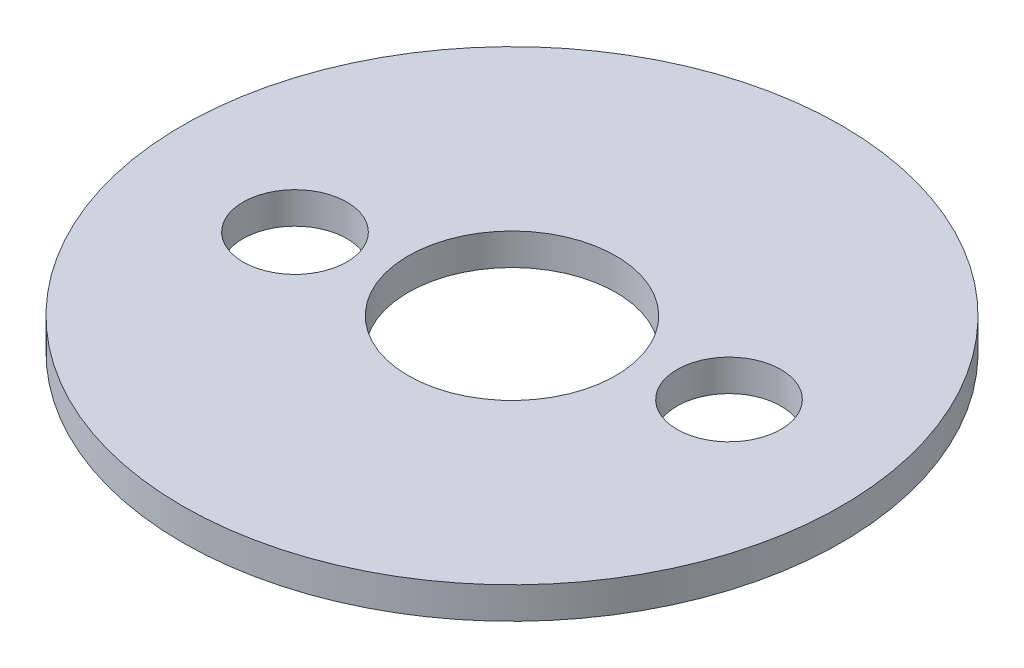
from build123d import *

# Parameters (mm, degrees)
SKETCH1_R           = 2.5
BOSS_EXTRUDE1_DEPTH = 4.7625
SKETCH2_R           = 7.9375
SKETCH2_R_2         = 2.5
BOSS_EXTRUDE2_DEPTH = 0.762
SKETCH4_R           = 1
CUT_EXTRUDE2_DEPTH  = 15.721869362
SKETCH5_R           = 1.25
CUT_EXTRUDE3_DEPTH  = 15.721869362


with BuildPart() as part:
    # Sketch1 → Boss-Extrude1 (new, symmetric)
    with BuildSketch(Plane(origin=(0, 0, 0), x_dir=(1, 0, 0), z_dir=(0, 1, 0))):
        with BuildLine():
            ThreePointArc((-1.850768, -6.777037356), (-1.816941892, -6.962421006), (-1.663291889, -7.071521784))
            ThreePointArc((-1.663291889, -7.071521784), (-1.417233644, -7.124914669), (-1.169472895, -7.169748489))
            ThreePointArc((-1.169472895, -7.169748489), (-0.985767742, -7.127751824), (-0.883573242, -6.969424355))
            ThreePointArc((-0.883573242, -6.969424355), (-0.839120956, -6.792881518), (-0.773880597, -6.622919538))
            ThreePointArc((-0.773880597, -6.622919538), (0, -6.1245), (0.773880597, -6.622919538))
            ThreePointArc((0.773880597, -6.622919538), (0.839120956, -6.792881518), (0.883573242, -6.969424355))
            ThreePointArc((0.883573242, -6.969424355), (0.985767742, -7.127751824), (1.169472895, -7.169748489))
            ThreePointArc((1.169472895, -7.169748489), (1.417233644, -7.124914669), (1.663291889, -7.071521784))
            ThreePointArc((1.663291889, -7.071521784), (1.816941892, -6.962421006), (1.850768, -6.777037356))
            ThreePointArc((1.850768, -6.777037356), (1.824276538, -6.596921889), (1.819509137, -6.414931089))
            ThreePointArc((1.819509137, -6.414931089), (2.343744682, -5.658300197), (3.249454025, -5.822628523))
            ThreePointArc((3.249454025, -5.822628523), (3.374769892, -5.954686513), (3.483398468, -6.100779674))
            ThreePointArc((3.483398468, -6.100779674), (3.638403174, -6.20794704), (3.824196033, -6.176445981))
            ThreePointArc((3.824196033, -6.176445981), (4.035939958, -6.040210999), (4.242835561, -5.896719991))
            ThreePointArc((4.242835561, -5.896719991), (4.343038594, -5.737124705), (4.303346591, -5.552907854))
            ThreePointArc((4.303346591, -5.552907854), (4.209944466, -5.396640704), (4.135895098, -5.230327534))
            ThreePointArc((4.135895098, -5.230327534), (4.330675481, -4.330675481), (5.230327534, -4.135895098))
            ThreePointArc((5.230327534, -4.135895098), (5.396640704, -4.209944466), (5.552907854, -4.303346591))
            ThreePointArc((5.552907854, -4.303346591), (5.737124705, -4.343038594), (5.896719991, -4.242835561))
            ThreePointArc((5.896719991, -4.242835561), (6.040210999, -4.035939958), (6.176445981, -3.824196033))
            ThreePointArc((6.176445981, -3.824196033), (6.20794704, -3.638403174), (6.100779674, -3.483398468))
            ThreePointArc((6.100779674, -3.483398468), (5.954686513, -3.374769892), (5.822628523, -3.249454025))
            ThreePointArc((5.822628523, -3.249454025), (5.658300197, -2.343744682), (6.414931089, -1.819509137))
            ThreePointArc((6.414931089, -1.819509137), (6.596921889, -1.824276538), (6.777037356, -1.850768))
            ThreePointArc((6.777037356, -1.850768), (6.962421006, -1.816941892), (7.071521784, -1.663291889))
            ThreePointArc((7.071521784, -1.663291889), (7.124914669, -1.417233644), (7.169748489, -1.169472895))
            ThreePointArc((7.169748489, -1.169472895), (7.127751824, -0.985767742), (6.969424355, -0.883573242))
            ThreePointArc((6.969424355, -0.883573242), (6.792881518, -0.839120956), (6.622919538, -0.773880597))
            ThreePointArc((6.622919538, -0.773880597), (6.1245, 0), (6.622919538, 0.773880597))
            ThreePointArc((6.622919538, 0.773880597), (6.792881518, 0.839120956), (6.969424355, 0.883573242))
            ThreePointArc((6.969424355, 0.883573242), (7.127751824, 0.985767742), (7.169748489, 1.169472895))
            ThreePointArc((7.169748489, 1.169472895), (7.124914669, 1.417233644), (7.071521784, 1.663291889))
            ThreePointArc((7.071521784, 1.663291889), (6.962421006, 1.816941892), (6.777037356, 1.850768))
            ThreePointArc((6.777037356, 1.850768), (6.596921889, 1.824276538), (6.414931089, 1.819509137))
            ThreePointArc((6.414931089, 1.819509137), (5.658300197, 2.343744682), (5.822628523, 3.249454025))
            ThreePointArc((5.822628523, 3.249454025), (5.954686513, 3.374769892), (6.100779674, 3.483398468))
            ThreePointArc((6.100779674, 3.483398468), (6.20794704, 3.638403174), (6.176445981, 3.824196033))
            ThreePointArc((6.176445981, 3.824196033), (6.040210999, 4.035939958), (5.896719991, 4.242835561))
            ThreePointArc((5.896719991, 4.242835561), (5.737124705, 4.343038594), (5.552907854, 4.303346591))
            ThreePointArc((5.552907854, 4.303346591), (5.396640704, 4.209944466), (5.230327534, 4.135895098))
            ThreePointArc((5.230327534, 4.135895098), (4.330675481, 4.330675481), (4.135895098, 5.230327534))
            ThreePointArc((4.135895098, 5.230327534), (4.209944466, 5.396640704), (4.303346591, 5.552907854))
            ThreePointArc((4.303346591, 5.552907854), (4.343038594, 5.737124705), (4.242835561, 5.896719991))
            ThreePointArc((4.242835561, 5.896719991), (4.035939958, 6.040210999), (3.824196033, 6.176445981))
            ThreePointArc((3.824196033, 6.176445981), (3.638403174, 6.20794704), (3.483398468, 6.100779674))
            ThreePointArc((3.483398468, 6.100779674), (3.374769892, 5.954686513), (3.249454025, 5.822628523))
            ThreePointArc((3.249454025, 5.822628523), (2.343744682, 5.658300197), (1.819509137, 6.414931089))
            ThreePointArc((1.819509137, 6.414931089), (1.824276538, 6.596921889), (1.850768, 6.777037356))
            ThreePointArc((1.850768, 6.777037356), (1.816941892, 6.962421006), (1.663291889, 7.071521784))
            ThreePointArc((1.663291889, 7.071521784), (1.417233644, 7.124914669), (1.169472895, 7.169748489))
            ThreePointArc((1.169472895, 7.169748489), (0.985767742, 7.127751824), (0.883573242, 6.969424355))
            ThreePointArc((0.883573242, 6.969424355), (0.839120956, 6.792881518), (0.773880597, 6.622919538))
            ThreePointArc((0.773880597, 6.622919538), (0, 6.1245), (-0.773880597, 6.622919538))
            ThreePointArc((-0.773880597, 6.622919538), (-0.839120956, 6.792881518), (-0.883573242, 6.969424355))
            ThreePointArc((-0.883573242, 6.969424355), (-0.985767742, 7.127751824), (-1.169472895, 7.169748489))
            ThreePointArc((-1.169472895, 7.169748489), (-1.417233644, 7.124914669), (-1.663291889, 7.071521784))
            ThreePointArc((-1.663291889, 7.071521784), (-1.816941892, 6.962421006), (-1.850768, 6.777037356))
            ThreePointArc((-1.850768, 6.777037356), (-1.824276538, 6.596921889), (-1.819509137, 6.414931089))
            ThreePointArc((-1.819509137, 6.414931089), (-2.343744682, 5.658300197), (-3.249454025, 5.822628523))
            ThreePointArc((-3.249454025, 5.822628523), (-3.374769892, 5.954686513), (-3.483398468, 6.100779674))
            ThreePointArc((-3.483398468, 6.100779674), (-3.638403174, 6.20794704), (-3.824196033, 6.176445981))
            ThreePointArc((-3.824196033, 6.176445981), (-4.035939958, 6.040210999), (-4.242835561, 5.896719991))
            ThreePointArc((-4.242835561, 5.896719991), (-4.343038594, 5.737124705), (-4.303346591, 5.552907854))
            ThreePointArc((-4.303346591, 5.552907854), (-4.209944466, 5.396640704), (-4.135895098, 5.230327534))
            ThreePointArc((-4.135895098, 5.230327534), (-4.330675481, 4.330675481), (-5.230327534, 4.135895098))
            ThreePointArc((-5.230327534, 4.135895098), (-5.396640704, 4.209944466), (-5.552907854, 4.303346591))
            ThreePointArc((-5.552907854, 4.303346591), (-5.737124705, 4.343038594), (-5.896719991, 4.242835561))
            ThreePointArc((-5.896719991, 4.242835561), (-6.040210999, 4.035939958), (-6.176445981, 3.824196033))
            ThreePointArc((-6.176445981, 3.824196033), (-6.20794704, 3.638403174), (-6.100779674, 3.483398468))
            ThreePointArc((-6.100779674, 3.483398468), (-5.954686513, 3.374769892), (-5.822628523, 3.249454025))
            ThreePointArc((-5.822628523, 3.249454025), (-5.658300197, 2.343744682), (-6.414931089, 1.819509137))
            ThreePointArc((-6.414931089, 1.819509137), (-6.596921889, 1.824276538), (-6.777037356, 1.850768))
            ThreePointArc((-6.777037356, 1.850768), (-6.962421006, 1.816941892), (-7.071521784, 1.663291889))
            ThreePointArc((-7.071521784, 1.663291889), (-7.124914669, 1.417233644), (-7.169748489, 1.169472895))
            ThreePointArc((-7.169748489, 1.169472895), (-7.127751824, 0.985767742), (-6.969424355, 0.883573242))
            ThreePointArc((-6.969424355, 0.883573242), (-6.792881518, 0.839120956), (-6.622919538, 0.773880597))
            ThreePointArc((-6.622919538, 0.773880597), (-6.1245, 0), (-6.622919538, -0.773880597))
            ThreePointArc((-6.622919538, -0.773880597), (-6.792881518, -0.839120956), (-6.969424355, -0.883573242))
            ThreePointArc((-6.969424355, -0.883573242), (-7.127751824, -0.985767742), (-7.169748489, -1.169472895))
            ThreePointArc((-7.169748489, -1.169472895), (-7.124914669, -1.417233644), (-7.071521784, -1.663291889))
            ThreePointArc((-7.071521784, -1.663291889), (-6.962421006, -1.816941892), (-6.777037356, -1.850768))
            ThreePointArc((-6.777037356, -1.850768), (-6.596921889, -1.824276538), (-6.414931089, -1.819509137))
            ThreePointArc((-6.414931089, -1.819509137), (-5.658300197, -2.343744682), (-5.822628523, -3.249454025))
            ThreePointArc((-5.822628523, -3.249454025), (-5.954686513, -3.374769892), (-6.100779674, -3.483398468))
            ThreePointArc((-6.100779674, -3.483398468), (-6.20794704, -3.638403174), (-6.176445981, -3.824196033))
            ThreePointArc((-6.176445981, -3.824196033), (-6.040210999, -4.035939958), (-5.896719991, -4.242835561))
            ThreePointArc((-5.896719991, -4.242835561), (-5.737124705, -4.343038594), (-5.552907854, -4.303346591))
            ThreePointArc((-5.552907854, -4.303346591), (-5.396640704, -4.209944466), (-5.230327534, -4.135895098))
            ThreePointArc((-5.230327534, -4.135895098), (-4.330675481, -4.330675481), (-4.135895098, -5.230327534))
            ThreePointArc((-4.135895098, -5.230327534), (-4.209944466, -5.396640704), (-4.303346591, -5.552907854))
            ThreePointArc((-4.303346591, -5.552907854), (-4.343038594, -5.737124705), (-4.242835561, -5.896719991))
            ThreePointArc((-4.242835561, -5.896719991), (-4.035939958, -6.040210999), (-3.824196033, -6.176445981))
            ThreePointArc((-3.824196033, -6.176445981), (-3.638403174, -6.20794704), (-3.483398468, -6.100779674))
            ThreePointArc((-3.483398468, -6.100779674), (-3.374769892, -5.954686513), (-3.249454025, -5.822628523))
            ThreePointArc((-3.249454025, -5.822628523), (-2.343744682, -5.658300197), (-1.819509137, -6.414931089))
            ThreePointArc((-1.819509137, -6.414931089), (-1.824276538, -6.596921889), (-1.850768, -6.777037356))
        make_face()
        Circle(SKETCH1_R, mode=Mode.SUBTRACT)
    extrude(amount=BOSS_EXTRUDE1_DEPTH, both=True)

    # Sketch4 → Cut-Extrude2 (cut, through all)
    with BuildSketch(Plane.XZ.offset(4.7625)):
        with Locations((-4.359590571, 0.867176481)):
            Circle(SKETCH4_R)
        with Locations((4.359590571, -0.867176481)):
            Circle(SKETCH4_R)
    extrude(amount=-CUT_EXTRUDE2_DEPTH, mode=Mode.SUBTRACT)


with BuildPart() as body_2:
    # Sketch2 → Boss-Extrude2 (new body)
    with BuildSketch(Plane.XZ.offset(4.7625)):
        Circle(SKETCH2_R)
        Circle(SKETCH2_R_2, mode=Mode.SUBTRACT)
    extrude(amount=BOSS_EXTRUDE2_DEPTH)

    # Sketch5 → Cut-Extrude3 (cut, through all)
    with BuildSketch(Plane(origin=(0, -4.7625, 0), x_dir=(1, 0, 0), z_dir=(0, 1, 0))):
        with Locations((-4.359590571, -0.867176481)):
            Circle(SKETCH5_R)
        with Locations((4.359590571, 0.867176481)):
            Circle(SKETCH5_R)
    extrude(amount=-CUT_EXTRUDE3_DEPTH, mode=Mode.SUBTRACT)


solid = body_2.part
